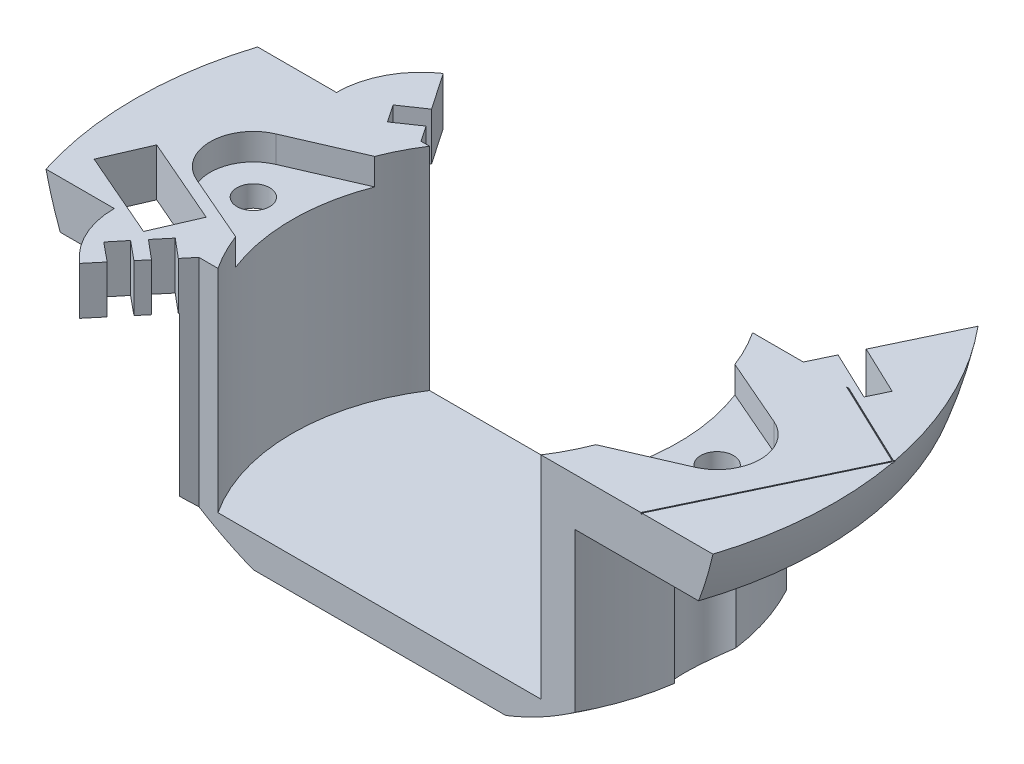
from build123d import *

# Parameters (mm, degrees)
SKETCH2_R           = 33.8
CUT_EXTRUDE1_DEPTH  = 7
SKETCH3_OUTSIDE_W   = 87.592
SKETCH3_OUTSIDE_H   = 87.592
CUT_EXTRUDE2_DEPTH  = 54.899165114
CUT_EXTRUDE3_DEPTH  = 2.5
SKETCH6_R           = 18.25
SKETCH6_R_2         = 1.55
CUT_EXTRUDE4_DEPTH  = 17.5
CUT_EXTRUDE5_START  = -4.5
SKETCH7_OUTSIDE_W   = 84.24
SKETCH7_OUTSIDE_H   = 55.421
SKETCH7_OUTSIDE_R   = 21
CUT_EXTRUDE5_DEPTH  = 44.045494858
CUT_EXTRUDE6_START  = -3
SKETCH8_R           = 33.067204297
CUT_EXTRUDE6_DEPTH  = 42.071919366
CUT_EXTRUDE7_REACH  = 45.412
SKETCH9_R           = 3.1
CUT_EXTRUDE8_DEPTH  = 0.1
CUT_EXTRUDE9_DEPTH  = 46.511911399
CUT_EXTRUDE11_DEPTH = 46.511911399


with BuildPart() as part:
    # Sketch1 → Revolve1 (revolve)
    with BuildSketch(Plane.XY):
        with BuildLine():
            Line((0, -33.8), (0, 0))
            Line((0, 0), (33.8, 0))
            ThreePointArc((33.8, 0), (23.900209204, -23.900209204), (0, -33.8))
        make_face()
    revolve(axis=Axis((0, -33.8, 0), (0, 1, 0)))

    # Sketch2 → Cut-Extrude1 (cut)
    with BuildSketch(Plane(origin=(0, 0, 0), x_dir=(1, 0, 0), z_dir=(0, 1, 0))):
        Circle(SKETCH2_R)
    extrude(amount=-CUT_EXTRUDE1_DEPTH, mode=Mode.SUBTRACT)

    # Sketch3 outside → Cut-Extrude2 (cut, through all)
    with BuildSketch(Plane(origin=(0, -7, 0), x_dir=(1, 0, 0), z_dir=(0, 1, 0))):
        Rectangle(SKETCH3_OUTSIDE_W, SKETCH3_OUTSIDE_H)
        with BuildLine():
            ThreePointArc((-25.067204297, -10), (-24.317666593, -13.380946094), (-22.209505174, -16.128355545))
            Line((-22.209505174, -16.128355545), (-17.067204297, -10))
            Line((-17.067204297, -10), (33.067204297, -10))
            Line((33.067204297, -10), (33.067204297, 10))
            Line((33.067204297, 10), (31.518883229, 10))
            ThreePointArc((31.518883229, 10), (28.997994188, 15.892021051), (25.387909, 21.187120536))
            Line((25.387909, 21.187120536), (21.982962022, 14.02800264))
            Line((21.982962022, 14.02800264), (26.654595174, 11.806127905))
            Line((26.654595174, 11.806127905), (25.795582955, 10))
            Line((25.795582955, 10), (21.123949803, 12.221874736))
            Line((21.123949803, 12.221874736), (20.067204297, 10))
            Line((20.067204297, 10), (-16.067204297, 10))
            Line((-16.067204297, 10), (-17.077026202, 11.478593558))
            Line((-17.077026202, 11.478593558), (-19.242000935, 10))
            Line((-19.242000935, 10), (-20.369962843, 11.651575592))
            Line((-20.369962843, 11.651575592), (-18.20498811, 13.13016915))
            Line((-18.20498811, 13.13016915), (-20.579051928, 16.606302366))
            ThreePointArc((-20.579051928, 16.606302366), (-23.141622331, 13.735319193), (-24.067204297, 10))
            Line((-24.067204297, 10), (-33.067204297, 10))
            Line((-33.067204297, 10), (-33.067204297, -10))
            Line((-33.067204297, -10), (-25.067204297, -10))
        make_face(mode=Mode.SUBTRACT)
    extrude(amount=-CUT_EXTRUDE2_DEPTH, mode=Mode.SUBTRACT)

    # Sketch5 → Cut-Extrude3 (cut)
    with BuildSketch(Plane(origin=(0, -7, 0), x_dir=(1, 0, 0), z_dir=(0, 1, 0))):
        with BuildLine():
            ThreePointArc((17.025732229, 6.571677263), (0, 18.25), (-17.025732229, 6.571677263))
            Line((-17.025732229, 6.571677263), (-23.544283672, 3.742739979))
            ThreePointArc((-23.544283672, 3.742739979), (-26, 0), (-23.544283672, -3.742739979))
            Line((-23.544283672, -3.742739979), (-17.025732229, -6.571677263))
            ThreePointArc((-17.025732229, -6.571677263), (0, -18.25), (17.025732229, -6.571677263))
            Line((17.025732229, -6.571677263), (23.544283672, -3.742739979))
            ThreePointArc((23.544283672, -3.742739979), (26, 0), (23.544283672, 3.742739979))
            Line((23.544283672, 3.742739979), (17.025732229, 6.571677263))
        make_face()
    extrude(amount=-CUT_EXTRUDE3_DEPTH, mode=Mode.SUBTRACT)

    # Sketch6 → Cut-Extrude4 (cut)
    with BuildSketch(Plane(origin=(0, -9.5, 0), x_dir=(1, 0, 0), z_dir=(0, 1, 0))):
        Circle(SKETCH6_R)
        with Locations((-21.92, 0)):
            Circle(SKETCH6_R_2)
        with Locations((21.92, 0)):
            Circle(SKETCH6_R_2)
    extrude(amount=-CUT_EXTRUDE4_DEPTH, mode=Mode.SUBTRACT)

    # Sketch7 outside → Cut-Extrude5 (cut, through all)
    with BuildSketch(Plane(origin=(0, -7, 0), x_dir=(1, 0, 0), z_dir=(0, 1, 0)).offset(CUT_EXTRUDE5_START)):
        with Locations((0, 2.5295)):
            Rectangle(SKETCH7_OUTSIDE_W, SKETCH7_OUTSIDE_H)
        Circle(SKETCH7_OUTSIDE_R, mode=Mode.SUBTRACT)
    extrude(amount=-CUT_EXTRUDE5_DEPTH, mode=Mode.SUBTRACT)

    # Sketch8 → Cut-Extrude6 (cut, through all)
    with BuildSketch(Plane(origin=(0, -27, 0), x_dir=(1, 0, 0), z_dir=(0, 1, 0)).offset(CUT_EXTRUDE6_START)):
        Circle(SKETCH8_R)
    extrude(amount=-CUT_EXTRUDE6_DEPTH, mode=Mode.SUBTRACT)

    # Sketch9 → Cut-Extrude7 (cut, up to next)
    with BuildSketch(Plane.XZ.offset(11.5), mode=Mode.PRIVATE) as cut_extrude7_sk1:
        with Locations((-21.92, 0)):
            Circle(SKETCH9_R)
    cut_extrude7_tool1 = extrude(cut_extrude7_sk1.sketch, amount=CUT_EXTRUDE7_REACH, mode=Mode.PRIVATE) & part.part
    # Sketch9 → Cut-Extrude7 (cut, up to next)
    with BuildSketch(Plane.XZ.offset(11.5), mode=Mode.PRIVATE) as cut_extrude7_sk2:
        with Locations((21.92, 0)):
            Circle(SKETCH9_R)
    cut_extrude7_tool2 = extrude(cut_extrude7_sk2.sketch, amount=CUT_EXTRUDE7_REACH, mode=Mode.PRIVATE) & part.part
    add(cut_extrude7_tool1.solids().sort_by_distance((-21.92, -11.5, 0))[0], mode=Mode.SUBTRACT)
    add(cut_extrude7_tool2.solids().sort_by_distance((21.92, -11.5, 0))[0], mode=Mode.SUBTRACT)

    # Sketch11 → Cut-Extrude8 (cut)
    with BuildSketch(Plane(origin=(0, -7, 0), x_dir=(1, 0, 0), z_dir=(0, 1, 0))):
        with BuildLine():
            Line((32.358992514, 6.09216546), (24.705400138, -10))
            Line((24.705400138, -10), (24.816134267, -10))
            Line((24.816134267, -10), (32.431508184, 6.011808715))
            ThreePointArc((32.431508184, 6.011808715), (32.625506527, 6.186877028), (32.364536991, 6.200262581))
            Line((32.364536991, 6.200262581), (24.375347046, 10))
            Line((24.375347046, 10), (24.142521487, 10))
            Line((24.142521487, 10), (32.358992514, 6.09216546))
        make_face()
    extrude(amount=-CUT_EXTRUDE8_DEPTH, mode=Mode.SUBTRACT)

    # Sketch12 → Cut-Extrude9 (cut, through all)
    with BuildSketch(Plane(origin=(0, -7, 0), x_dir=(1, 0, 0), z_dir=(0, 1, 0))):
        Polygon((-20.919764883, -10.919942081), (-19.111972574, -12.43685994), (-17.954954876, -11.057979943), (-19.762747185, -9.541062083), align=None)
        Polygon((-19.284697801, -13.813154354), (-21.680837472, -11.847864218), (-22.822338957, -13.23961648), (-20.426199286, -15.204906616), align=None)
    extrude(amount=-CUT_EXTRUDE9_DEPTH, mode=Mode.SUBTRACT)

    # Sketch14 → Cut-Extrude11 (cut, through all)
    with BuildSketch(Plane(origin=(0, -7, 0), x_dir=(1, 0, 0), z_dir=(0, 1, 0))):
        Polygon((-30.059430498, -6.910887768), (-21.803386426, -10.493866456), (-20.011897082, -6.36584442), (-28.267941154, -2.782865732), align=None)
    extrude(amount=-CUT_EXTRUDE11_DEPTH, mode=Mode.SUBTRACT)


solid = part.part
